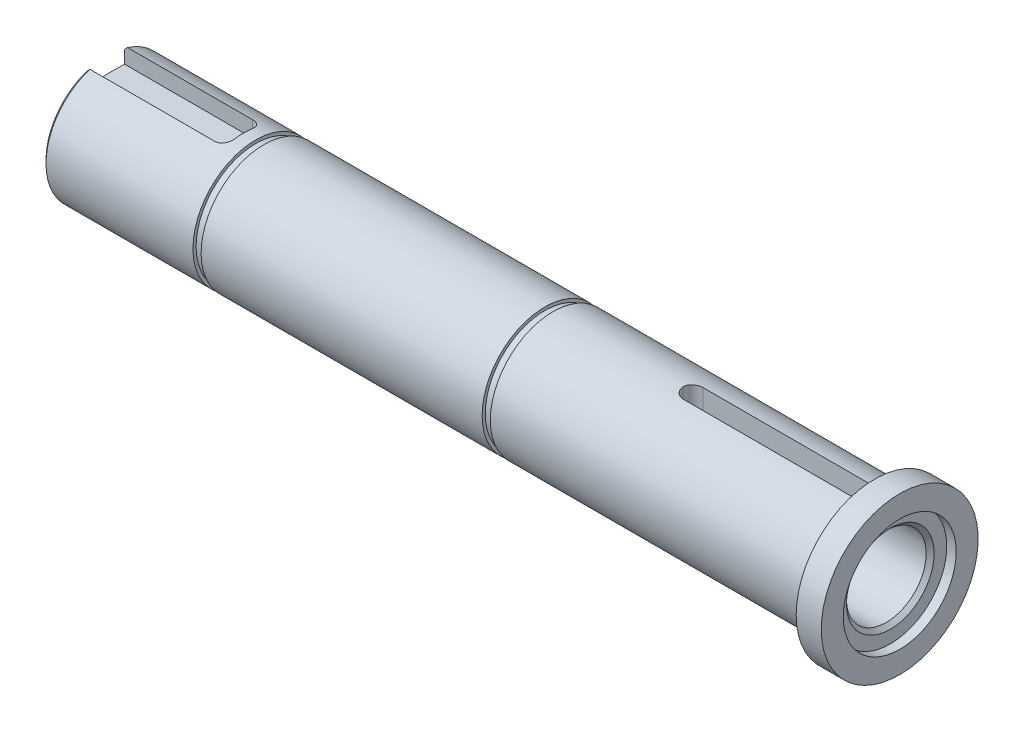
from build123d import *

# Parameters (mm, degrees)
F_1_2_0_5_DIAMETER_HOLE1_D           = 12.7
F_1_2_0_5_DIAMETER_HOLE1_DEPTH       = 38
F_1_2_0_5_DIAMETER_HOLE1_CSINK_D     = 13.97
F_1_2_0_5_DIAMETER_HOLE1_CSINK_ANGLE = 90
F_1_2_0_5_DIAMETER_HOLE1_TIP         = 3.815464931
FILLET1_R                            = 0.5
CUT_EXTRUDE2_DEPTH                   = 22
FILLET2_R                            = 1.5875
CHAMFER2_SIZE                        = 0.5
M8X1_25_TAPPED_HOLE1_D               = 6.8
M8X1_25_TAPPED_HOLE1_DEPTH           = 30
M8X1_25_TAPPED_HOLE1_TIP             = 2.042926105
CUT_EXTRUDE3_REACH                   = 131.151
CUT_EXTRUDE3_END_RADIUS              = 6.35
SKETCH9_W                            = 29.7
SKETCH9_H                            = 3.175
FILLET4_R                            = 1.5875


with BuildPart() as part:
    # Sketch1 → Revolve1 (revolve)
    with BuildSketch(Plane.XY, mode=Mode.PRIVATE) as revolve1_sk:
        Polygon((0, 0), (0, 10), (23.92, 10), (23.92, 9.5), (25.22, 9.5), (25.22, 10), (70.01, 10), (70.01, 9.5), (71.31, 9.5), (71.31, 10), (122.56, 10), (122.56, 12.5), (126.56, 12.5), (126.56, 9), (125.06, 9), (125.06, 6.375), (125.06, 0), (87.56, 0), align=None)
    revolve(revolve1_sk.sketch.rotate(Axis((-9.141012775, 0, 0), (1, 0, 0)), 90), axis=Axis((-9.141012775, 0, 0), (1, 0, 0)))

    # 1/2 (0.5) Diameter Hole1
    with Locations(Plane(origin=(125.06, 0, 0), x_dir=(0, 0, -1), z_dir=(1, 0, 0))):
        with Locations((0, 0)):
            CounterSinkHole(F_1_2_0_5_DIAMETER_HOLE1_D / 2, F_1_2_0_5_DIAMETER_HOLE1_CSINK_D / 2, depth=F_1_2_0_5_DIAMETER_HOLE1_DEPTH, counter_sink_angle=F_1_2_0_5_DIAMETER_HOLE1_CSINK_ANGLE)
            with Locations((0, 0, -(F_1_2_0_5_DIAMETER_HOLE1_DEPTH + F_1_2_0_5_DIAMETER_HOLE1_TIP / 2))):  # 118° drill point
                Cone(0, F_1_2_0_5_DIAMETER_HOLE1_D / 2, F_1_2_0_5_DIAMETER_HOLE1_TIP, mode=Mode.SUBTRACT)

    # Fillet1
    fillet1_edges = [part.edges().sort_by_distance(p)[0] for p in [
        (122.56, 0, -10),
    ]]
    fillet(fillet1_edges, radius=FILLET1_R)

    # Sketch6 → Cut-Extrude2 (cut)
    with BuildSketch(Plane.ZY):
        Polygon((-3, 73.427602241), (-3, 9.539392014), (-3, 7), (3, 7), (3, 9.539392014), (3, 73.427602241), (3, 201.204022694), (-3, 201.204022694), align=None)
    extrude(amount=-CUT_EXTRUDE2_DEPTH, mode=Mode.SUBTRACT)

    # Fillet2
    fillet2_edges = [part.edges().sort_by_distance(p)[0] for p in [
        (22, 8.269696007, -3),
        (22, 8.269696007, 3),
    ]]
    fillet(fillet2_edges, radius=FILLET2_R)

    # Chamfer2
    chamfer2_edges = [part.edges().sort_by_distance(p)[0] for p in [
        (0, -8.062257748, -5.916079783),
    ]]
    chamfer(chamfer2_edges, length=CHAMFER2_SIZE)

    # M8x1.25 Tapped Hole1
    with Locations(Plane.ZY):
        with Locations((0, 0)):
            Hole(M8X1_25_TAPPED_HOLE1_D / 2, depth=M8X1_25_TAPPED_HOLE1_DEPTH)
            with Locations((0, 0, -(M8X1_25_TAPPED_HOLE1_DEPTH + M8X1_25_TAPPED_HOLE1_TIP / 2))):  # 118° drill point
                Cone(0, M8X1_25_TAPPED_HOLE1_D / 2, M8X1_25_TAPPED_HOLE1_TIP, mode=Mode.SUBTRACT)

    # Cut-Extrude3: up to this cylinder (the profile starts outside it)
    cut_extrude3_end = Plane(origin=(106.91, 0, 0), z_dir=(1, 0, 0)) * Cylinder(CUT_EXTRUDE3_END_RADIUS, 276.002, mode=Mode.PRIVATE)
    # Sketch9 → Cut-Extrude3 (cut, up to the surface)
    with BuildSketch(Plane(origin=(0, 10, 0), x_dir=(1, 0, 0), z_dir=(0, 1, 0)), mode=Mode.PRIVATE) as cut_extrude3_sk1:
        with Locations((106.91, 0)):
            Rectangle(SKETCH9_W, SKETCH9_H)
    cut_extrude3_tool1 = extrude(cut_extrude3_sk1.sketch, amount=-CUT_EXTRUDE3_REACH, mode=Mode.PRIVATE) - cut_extrude3_end
    add(cut_extrude3_tool1.solids().sort_by_distance((106.91, 10, 0))[0], mode=Mode.SUBTRACT)

    # Fillet4
    fillet4_edges = [part.edges().sort_by_distance(p)[0] for p in [
        (92.06, 8.010774594, 1.5875),
        (121.76, 8.010774594, 1.5875),
        (121.76, 8.010774594, -1.5875),
        (92.06, 8.010774594, -1.5875),
    ]]
    fillet(fillet4_edges, radius=FILLET4_R - 0.0001)  # a hair under: the kernel refuses the full size


solid = part.part
